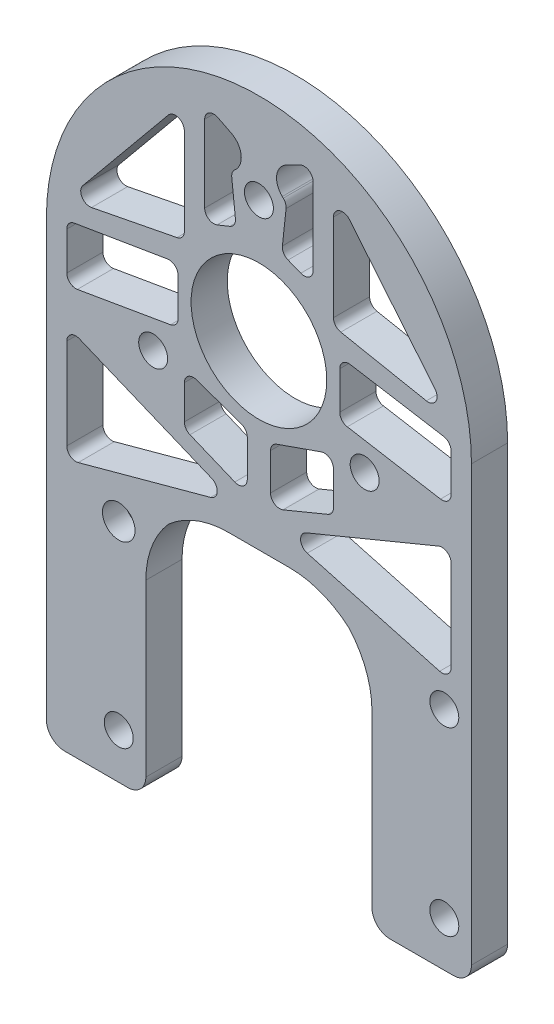
from build123d import *

# Parameters (mm, degrees)
SKETCH_1_R                   = 1.6
SKETCH_1_R_2                 = 7.5
EXTRUDE_1_DEPTH              = 4
SKETCH_2_R                   = 1.6
CUT_EXTRUDE_1_DEPTH          = 56.391786395
CUT_EXTRUDE_2_DEPTH          = 56.391786395
FILLET_2_R                   = 10
FILLET_3_R                   = 2
CUT_EXTRUDE_3_DEPTH          = 56.391786395
FILLET_4_R                   = 2
FILLET_5_R                   = 1
HOLE_WIZARD_M3_1_D           = 3.6
HOLE_WIZARD_M3_1_CSINK_D     = 6.6
HOLE_WIZARD_M3_1_CSINK_ANGLE = 90


with BuildPart() as part:
    # 草图1 → 凸台-拉伸1 (new body)
    with BuildSketch(Plane.XY):
        with BuildLine():
            Line((-23.5, 0), (-23.5, -50))
            Line((-23.5, -50), (23.5, -50))
            Line((23.5, -50), (23.5, 0))
            ThreePointArc((23.5, 0), (0, 23.5), (-23.5, 0))
        make_face()
        with Locations((0, 13.5)):
            Circle(SKETCH_1_R, mode=Mode.SUBTRACT)
        with Locations((11.691342951, -6.75)):
            Circle(SKETCH_1_R, mode=Mode.SUBTRACT)
        with Locations((-11.691342951, -6.75)):
            Circle(SKETCH_1_R, mode=Mode.SUBTRACT)
        Circle(SKETCH_1_R_2, mode=Mode.SUBTRACT)
    extrude(amount=EXTRUDE_1_DEPTH)

    # 草图2 → 切除-拉伸1 (cut, through all)
    with BuildSketch(Plane.XY.offset(4)):
        with Locations((20.5, -45)):
            Circle(SKETCH_2_R)
        with Locations((20.5, -25)):
            Circle(SKETCH_2_R)
        with Locations((-15.5, -45)):
            Circle(SKETCH_2_R)
        with Locations((-15.5, -25)):
            Circle(SKETCH_2_R)
    extrude(amount=-CUT_EXTRUDE_1_DEPTH, mode=Mode.SUBTRACT)

    # 草图3 → 切除-拉伸2 (cut, through all)
    with BuildSketch(Plane.XY.offset(4)):
        Polygon((12.5, -25), (7.5, -20), (-7.5, -20), (-12.5, -25), (-12.5, -50), (12.5, -50), align=None)
    extrude(amount=-CUT_EXTRUDE_2_DEPTH, mode=Mode.SUBTRACT)

    # 圆角2
    # the kernel refuses this fillet: 10 mm, written as the material it adds along each edge
    with BuildSketch(Plane(origin=(-12.5, -25, 4), x_dir=(0, -1, 0), z_dir=(0, 0, -1))) as fillet_2_piece_1:
        with BuildLine():
            CenterArc((FILLET_2_R * 0.414213562373, -FILLET_2_R), FILLET_2_R, 90, 45)
            Line((-FILLET_2_R * 0.292893218813, -FILLET_2_R * 0.292893218813), (0, 0))
            Line((0, 0), (FILLET_2_R * 0.414213562373, 0))
        make_face()
    extrude(amount=4)
    with BuildSketch(Plane(origin=(-7.5, -20, 4), x_dir=(1, 0, 0), z_dir=(0, 0, -1)), Plane(origin=(7.5, -20, 4), x_dir=(0.7071067811865472, -0.7071067811865479, 0), z_dir=(0, 0, -1)), Plane(origin=(12.5, -25, 4), x_dir=(0, -1, 0), z_dir=(0, 0, -1))) as fillet_2_piece_2:
        with BuildLine():
            CenterArc((FILLET_2_R * 0.414213562373, FILLET_2_R), FILLET_2_R, 225, 45)
            Line((-FILLET_2_R * 0.292893218813, FILLET_2_R * 0.292893218813), (0, 0))
            Line((0, 0), (FILLET_2_R * 0.414213562373, 0))
        make_face()
    extrude(amount=4)

    # 圆角3
    fillet_3_edges = [part.edges().sort_by_distance(p)[0] for p in [
        (-12.5, -50, 2),
        (12.5, -50, 2),
        (23.5, -50, 2),
        (-23.5, -50, 2),
    ]]
    fillet(fillet_3_edges, radius=FILLET_3_R)

    # 草图4 → 切除-拉伸3 (cut, through all)
    with BuildSketch(Plane.XY.offset(4)):
        Polygon((8.242977091, 18.793122214), (21.245983207, 3.003757645), (8.242977091, 5.544260941), align=None)
        Polygon((5.998410559, 19.876706057), (5.998410559, 8.266879168), (2.515462493, 9.660058395), (3.057254414, 14.69098338), (0.503092499, 17.090347604), align=None)
        Polygon((21.245983207, 0.953850638), (21.245983207, -5.286408991), (8.939449972, -3.17573294), (8.939449972, 3.003757645), align=None)
        Polygon((21.245983207, -9.127756299), (21.245983207, -21.963810312), (2.515462493, -16.865803044), align=None)
        Polygon((8.242977091, -6.687008394), (8.242977091, -12.519465541), (1.285419198, -15.393806785), (1.285419198, -9.127756299), align=None)
        Polygon((-3.057254414, 14.69098338), (-0.503092499, 17.090347604), (-5.998410559, 19.876706057), (-5.998410559, 8.266879168), (-2.515462493, 9.660058395), align=None)
        Polygon((-21.245983207, 3.003757645), (-8.242977091, 5.544260941), (-8.242977091, 18.793122214), align=None)
        Polygon((-8.939449972, -3.17573294), (-8.939449972, 3.003757645), (-21.245983207, 0.953850638), (-21.245983207, -5.286408991), align=None)
        Polygon((-21.245983207, -21.963810312), (-2.515462493, -16.865803044), (-21.245983207, -9.127756299), align=None)
        Polygon((-1.285419198, -15.393806785), (-1.285419198, -9.127756299), (-8.242977091, -6.687008394), (-8.242977091, -12.519465541), align=None)
    extrude(amount=-CUT_EXTRUDE_3_DEPTH, mode=Mode.SUBTRACT)

    # 圆角4
    fillet_4_edges = [part.edges().sort_by_distance(p)[0] for p in [
        (0.503092499, 17.090347604, 2),
        (-0.503092499, 17.090347604, 2),
    ]]
    fillet(fillet_4_edges, radius=FILLET_4_R)

    # 圆角5
    fillet_5_edges = [part.edges().sort_by_distance(p)[0] for p in [
        (5.998410559, 19.876706057, 2),
        (5.998410559, 8.266879168, 2),
        (2.515462493, 9.660058395, 2),
        (3.057254414, 14.69098338, 2),
        (8.939449972, 3.003757645, 2),
        (21.245983207, 0.953850638, 2),
        (21.245983207, -5.286408991, 2),
        (8.939449972, -3.17573294, 2),
        (1.285419198, -9.127756299, 2),
        (8.242977091, -6.687008394, 2),
        (8.242977091, -12.519465541, 2),
        (1.285419198, -15.393806785, 2),
        (2.515462493, -16.865803044, 2),
        (21.245983207, -9.127756299, 2),
        (21.245983207, -21.963810312, 2),
        (-21.245983207, -21.963810312, 2),
        (-21.245983207, -9.127756299, 2),
        (-2.515462493, -16.865803044, 2),
        (-8.939449972, -3.17573294, 2),
        (-21.245983207, -5.286408991, 2),
        (-21.245983207, 0.953850638, 2),
        (-8.939449972, 3.003757645, 2),
        (-21.245983207, 3.003757645, 2),
        (-8.242977091, 18.793122214, 2),
        (-8.242977091, 5.544260941, 2),
        (-3.057254414, 14.69098338, 2),
        (-2.515462493, 9.660058395, 2),
        (-5.998410559, 8.266879168, 2),
        (-5.998410559, 19.876706057, 2),
        (-1.285419198, -15.393806785, 2),
        (-8.242977091, -12.519465541, 2),
        (-8.242977091, -6.687008394, 2),
        (-1.285419198, -9.127756299, 2),
        (8.242977091, 5.544260941, 2),
        (8.242977091, 18.793122214, 2),
        (21.245983207, 3.003757645, 2),
    ]]
    fillet(fillet_5_edges, radius=FILLET_5_R)

    # M3 十字槽半沉头木螺钉的锥形沉头孔1 (through all)
    with Locations(Plane(origin=(0, 0, 0), x_dir=(-1, 0, 0), z_dir=(0, 0, -1))):
        with Locations((15.5, -25)):
            CounterSinkHole(HOLE_WIZARD_M3_1_D / 2, HOLE_WIZARD_M3_1_CSINK_D / 2, counter_sink_angle=HOLE_WIZARD_M3_1_CSINK_ANGLE)


solid = part.part
